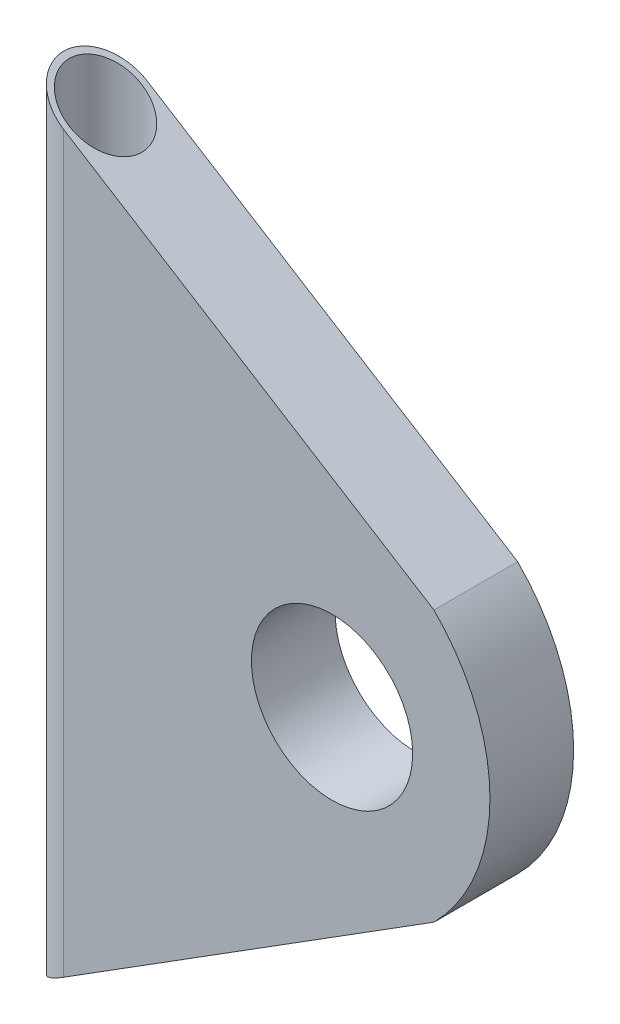
from build123d import *

# Parameters (mm, degrees)
SCHIZZO1_R                               = 2.88998006
ESTRUSIONE_ESTRUSIONE1_DEPTH             = 1.5
ESTRUSIONE_ESTRUSIONE3_REACH             = 22.293
SCHIZZO2_R                               = 1.5
ESTRUSIONE_ESTRUSIONE3_DIRECTION_2_REACH = 22.293
TAGLIO_ESTRUSIONE2_REACH                 = 22.922
SCHIZZO4_R                               = 1.297765186
TAGLIO_ESTRUSIONE2_DIRECTION_2_REACH     = 22.922


with BuildPart() as part:
    # Schizzo1 → Estrusione-Estrusione1 (new, symmetric)
    with BuildSketch(Plane.XY):
        with BuildLine():
            Line((0, 13.049548457), (0, -13.268113525))
            Line((0, -13.268113525), (13.27389022, -4.921847321))
            ThreePointArc((13.27389022, -4.921847321), (15.281259891, -0.075628235), (13.27389022, 4.770590851))
            Line((13.27389022, 4.770590851), (0, 13.049548457))
        make_face()
        with Locations((9.620551337, -0.075628235)):
            Circle(SCHIZZO1_R, mode=Mode.SUBTRACT)
    extrude(amount=ESTRUSIONE_ESTRUSIONE1_DEPTH, both=True)

    # Estrusione-Estrusione3: up to this plane
    estrusione_estrusione3_end = Plane(origin=(0, -13.268113525, 1.5), z_dir=(-0.5322939659189773, 0.8465595867074254, 0))
    # Schizzo2 → Estrusione-Estrusione3 (add, up to the surface)
    with BuildSketch(Plane(origin=(0, 0, 0), x_dir=(1, 0, 0), z_dir=(0, 1, 0)), mode=Mode.PRIVATE) as estrusione_estrusione3_sk1:
        Circle(SCHIZZO2_R)
    estrusione_estrusione3_tool1 = split(extrude(estrusione_estrusione3_sk1.sketch, amount=-ESTRUSIONE_ESTRUSIONE3_REACH, mode=Mode.PRIVATE), bisect_by=estrusione_estrusione3_end, keep=Keep.BOTH, mode=Mode.PRIVATE)
    add(estrusione_estrusione3_tool1.solids().sort_by_distance((0, 0, 0))[0])

    # Estrusione-Estrusione3 direction 2: up to this plane
    estrusione_estrusione3_direction_2_end = Plane(origin=(0, 13.049548457, 1.5), z_dir=(-0.5292069948810272, -0.848492755755164, 0))
    # Schizzo2 → Estrusione-Estrusione3 direction 2 (add, up to the surface)
    with BuildSketch(Plane(origin=(0, 0, 0), x_dir=(1, 0, 0), z_dir=(0, 1, 0)), mode=Mode.PRIVATE) as estrusione_estrusione3_direction_2_sk1:
        Circle(SCHIZZO2_R)
    estrusione_estrusione3_direction_2_tool1 = split(extrude(estrusione_estrusione3_direction_2_sk1.sketch, amount=ESTRUSIONE_ESTRUSIONE3_DIRECTION_2_REACH, mode=Mode.PRIVATE), bisect_by=estrusione_estrusione3_direction_2_end, keep=Keep.BOTH, mode=Mode.PRIVATE)
    add(estrusione_estrusione3_direction_2_tool1.solids().sort_by_distance((0, 0, 0))[0])

    # Taglio-Estrusione2: up to this plane
    taglio_estrusione2_end = Plane(origin=(0, -13.268113525, 1.5), z_dir=(-0.5322939659189773, 0.8465595867074254, 0))
    # Schizzo4 → Taglio-Estrusione2 (cut, up to the surface)
    with BuildSketch(Plane(origin=(0, 0, 0), x_dir=(1, 0, 0), z_dir=(0, 1, 0)), mode=Mode.PRIVATE) as taglio_estrusione2_sk1:
        Circle(SCHIZZO4_R)
    taglio_estrusione2_tool1 = split(extrude(taglio_estrusione2_sk1.sketch, amount=-TAGLIO_ESTRUSIONE2_REACH, mode=Mode.PRIVATE), bisect_by=taglio_estrusione2_end, keep=Keep.BOTH, mode=Mode.PRIVATE)
    add(taglio_estrusione2_tool1.solids().sort_by_distance((0, 0, 0))[0], mode=Mode.SUBTRACT)

    # Taglio-Estrusione2 direction 2: up to this plane
    taglio_estrusione2_direction_2_end = Plane(origin=(0, 13.049548457, 1.5), z_dir=(-0.5292069948810272, -0.848492755755164, 0))
    # Schizzo4 → Taglio-Estrusione2 direction 2 (cut, up to the surface)
    with BuildSketch(Plane(origin=(0, 0, 0), x_dir=(1, 0, 0), z_dir=(0, 1, 0)), mode=Mode.PRIVATE) as taglio_estrusione2_direction_2_sk1:
        Circle(SCHIZZO4_R)
    taglio_estrusione2_direction_2_tool1 = split(extrude(taglio_estrusione2_direction_2_sk1.sketch, amount=TAGLIO_ESTRUSIONE2_DIRECTION_2_REACH, mode=Mode.PRIVATE), bisect_by=taglio_estrusione2_direction_2_end, keep=Keep.BOTH, mode=Mode.PRIVATE)
    add(taglio_estrusione2_direction_2_tool1.solids().sort_by_distance((0, 0, 0))[0], mode=Mode.SUBTRACT)


solid = part.part
